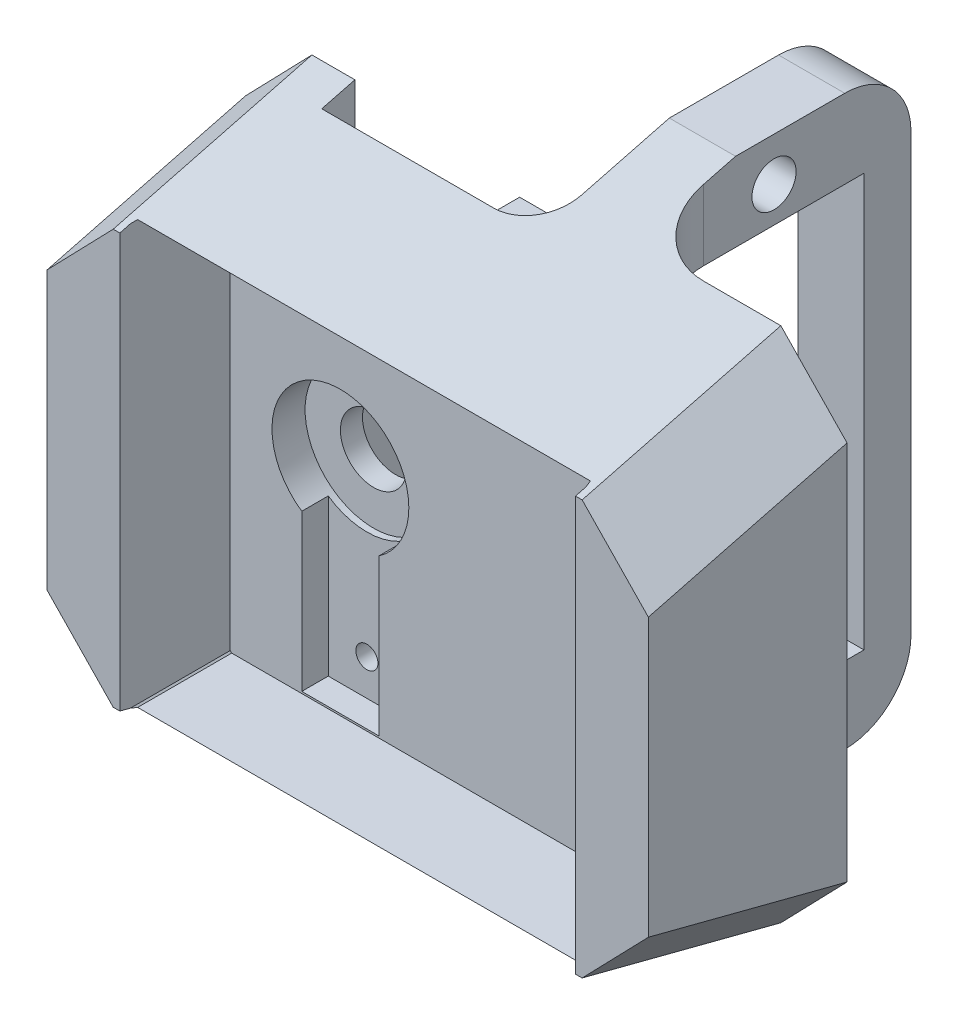
from build123d import *

# Parameters (mm, degrees)
SKETCH1_W                = 12.409227922
SKETCH1_H                = 25.738488059
SKETCH1_R                = 1
SKETCH1_W_2              = 8.15
SKETCH1_H_2              = 18.7
BOSS_EXTRUDE1_DEPTH      = 3
SKETCH15_W               = 27.240995133
SKETCH15_H               = 25.738488059
BOSS_EXTRUDE5_DEPTH      = 4
SKETCH16_R               = 3.1
CUT_EXTRUDE12_DEPTH      = 1.5
CUT_EXTRUDE13_DEPTH      = 1.2
CHAMFER1_SIZE            = 2
CUT_EXTRUDE14_DEPTH      = 31.943326143
CUT_EXTRUDE14_DEPTH_BACK = 31.943326143
SKETCH18_R               = 1.5
SKETCH18_R_2             = 0.5
FILLET1_R                = 3
FILLET2_R                = 3
BOSS_EXTRUDE7_DEPTH      = 5
CUT_EXTRUDE15_DEPTH      = 39.151604311
CUT_EXTRUDE15_DEPTH_BACK = 39.151604311
CHAMFER2_SIZE            = 3
SKETCH23_R               = 3.318889956
SKETCH23_R_2             = 1.409018686
CUT_EXTRUDE17_DEPTH      = 1
FILLET4_R                = 3
BOSS_EXTRUDE8_DEPTH      = 12.409227923
SKETCH25_R               = 1.5
CUT_EXTRUDE18_DEPTH      = 13
SKETCH26_R               = 2.992034133
CUT_EXTRUDE19_DEPTH      = 1
FILLET5_SIZE             = 8
FILLET6_R                = 4
SKETCH27_W               = 9.781799862
SKETCH27_H               = 23.423713079
CUT_EXTRUDE20_DEPTH      = 1.5
FILLET7_R                = 2


with BuildPart() as part:
    # Sketch1 → Boss-Extrude1 (new body)
    with BuildSketch(Plane(origin=(0, 0, 0), x_dir=(0, 0, -1), z_dir=(1, 0, 0))):
        with Locations((1.233520205, 9.896555647)):
            Rectangle(SKETCH1_W, SKETCH1_H)
        with Locations((1.233520205, 20.798227972)):
            Circle(SKETCH1_R, mode=Mode.SUBTRACT)
        with Locations((1.233520205, -1.111772028)):
            Circle(SKETCH1_R, mode=Mode.SUBTRACT)
        with Locations((1.233520205, 9.843227972)):
            Rectangle(SKETCH1_W_2, SKETCH1_H_2, mode=Mode.SUBTRACT)
    extrude(amount=BOSS_EXTRUDE1_DEPTH)

    # Sketch15 → Boss-Extrude5 (add)
    with BuildSketch(Plane.XY.offset(4.971093756)):
        with Locations((-1.10779903, 9.896555647)):
            Rectangle(SKETCH15_W, SKETCH15_H)
    extrude(amount=BOSS_EXTRUDE5_DEPTH)

    # Sketch16 → Cut-Extrude12 (cut)
    with BuildSketch(Plane.XY.offset(8.971093756)):
        with Locations((-6.437606402, 10.038669905)):
            Circle(SKETCH16_R)
    extrude(amount=-CUT_EXTRUDE12_DEPTH, mode=Mode.SUBTRACT)

    # Sketch17 → Cut-Extrude13 (cut)
    with BuildSketch(Plane.XY.offset(8.971093756)):
        Polygon((-6.437606402, 10.038669905), (-8.187606402, 10.038669905), (-8.187606402, 0.412009525), (-4.687606402, 0.412009525), (-4.687606402, 10.038669905), align=None)
    extrude(amount=-CUT_EXTRUDE13_DEPTH, mode=Mode.SUBTRACT)

    # Chamfer1
    chamfer1_edges = [part.edges().sort_by_distance(p)[0] for p in [
        (-14.728296596, 22.765799677, 6.971093756),
        (-14.728296596, -2.972688382, 6.971093756),
        (12.512698537, -2.972688382, 6.971093756),
        (12.512698537, 22.765799677, 6.971093756),
    ]]
    chamfer(chamfer1_edges, length=CHAMFER1_SIZE)

    # Sketch18 → Cut-Extrude14 (cut, two sides: drawn at the far end of the back side and taken through both)
    with BuildSketch(Plane.XY.offset(7.471093756).offset(-CUT_EXTRUDE14_DEPTH_BACK)):
        with Locations((-6.437606402, 10.038669905)):
            Circle(SKETCH18_R)
        with Locations((-6.437606402, 2.038669905)):
            Circle(SKETCH18_R_2)
    extrude(amount=CUT_EXTRUDE14_DEPTH + CUT_EXTRUDE14_DEPTH_BACK, mode=Mode.SUBTRACT)

    # Fillet1
    fillet1_edges = [part.edges().sort_by_distance(p)[0] for p in [
        (1.5, -2.972688382, -7.438134166),
        (1.5, 22.765799677, -7.438134166),
    ]]
    fillet(fillet1_edges, radius=FILLET1_R)

    # Fillet2
    # the kernel refuses this fillet: 3 mm, written as the material it adds along each edge
    with BuildSketch(Plane(origin=(3, -2.972688382, 4.971093756), x_dir=(0, 0, -1), z_dir=(0, 1, 0))) as fillet2_piece_1_section:
        with BuildLine():
            CenterArc((FILLET2_R, -FILLET2_R), FILLET2_R, 90, 90)
            Line((0, -FILLET2_R), (0, 0))
            Line((0, 0), (FILLET2_R, 0))
        make_face()
    fillet2_piece_1 = extrude(amount=25.738488059, mode=Mode.PRIVATE)
    fillet2_piece_1 = split(fillet2_piece_1, bisect_by=Plane(origin=(3, -2.972688382, 2.841479795), z_dir=(0, 0, -1)), keep=Keep.TOP, mode=Mode.PRIVATE)
    fillet2_piece_1 = split(fillet2_piece_1, bisect_by=Plane(origin=(3, 0.493227972, 4.971093756), z_dir=(0, -1, 0)), keep=Keep.TOP, mode=Mode.PRIVATE)
    add(fillet2_piece_1)
    with BuildSketch(Plane(origin=(3, -2.972688382, 4.971093756), x_dir=(0, 0, -1), z_dir=(0, 1, 0))) as fillet2_piece_2_section:
        with BuildLine():
            CenterArc((FILLET2_R, -FILLET2_R), FILLET2_R, 90, 90)
            Line((0, -FILLET2_R), (0, 0))
            Line((0, 0), (FILLET2_R, 0))
        make_face()
    fillet2_piece_2 = extrude(amount=25.738488059, mode=Mode.PRIVATE)
    fillet2_piece_2 = split(fillet2_piece_2, bisect_by=Plane(origin=(3, -2.972688382, 2.841479795), z_dir=(0, 0, 1)), keep=Keep.TOP, mode=Mode.PRIVATE)
    fillet2_piece_2 = split(fillet2_piece_2, bisect_by=Plane(origin=(3, 0.493227972, 4.971093756), z_dir=(0, -1, 0)), keep=Keep.TOP, mode=Mode.PRIVATE)
    add(fillet2_piece_2)
    with BuildSketch(Plane(origin=(3, -2.972688382, 4.971093756), x_dir=(0, 0, -1), z_dir=(0, 1, 0))) as fillet2_piece_3_section:
        with BuildLine():
            CenterArc((FILLET2_R, -FILLET2_R), FILLET2_R, 90, 90)
            Line((0, -FILLET2_R), (0, 0))
            Line((0, 0), (FILLET2_R, 0))
        make_face()
    fillet2_piece_3 = extrude(amount=25.738488059, mode=Mode.PRIVATE)
    fillet2_piece_3 = split(fillet2_piece_3, bisect_by=Plane(origin=(3, 19.193227972, 4.971093756), z_dir=(0, -1, 0)), keep=Keep.TOP, mode=Mode.PRIVATE)
    fillet2_piece_3 = split(fillet2_piece_3, bisect_by=Plane(origin=(3, -2.972688382, 2.841479795), z_dir=(0, 0, 1)), keep=Keep.TOP, mode=Mode.PRIVATE)
    fillet2_piece_3 = split(fillet2_piece_3, bisect_by=Plane(origin=(3, 0.493227972, 4.971093756), z_dir=(0, 1, 0)), keep=Keep.TOP, mode=Mode.PRIVATE)
    add(fillet2_piece_3)
    with BuildSketch(Plane(origin=(3, -2.972688382, 4.971093756), x_dir=(0, 0, -1), z_dir=(0, 1, 0))) as fillet2_piece_4_section:
        with BuildLine():
            CenterArc((FILLET2_R, -FILLET2_R), FILLET2_R, 90, 90)
            Line((0, -FILLET2_R), (0, 0))
            Line((0, 0), (FILLET2_R, 0))
        make_face()
    fillet2_piece_4 = extrude(amount=25.738488059, mode=Mode.PRIVATE)
    fillet2_piece_4 = split(fillet2_piece_4, bisect_by=Plane(origin=(3, 19.193227972, 4.971093756), z_dir=(0, 1, 0)), keep=Keep.TOP, mode=Mode.PRIVATE)
    fillet2_piece_4 = split(fillet2_piece_4, bisect_by=Plane(origin=(3, -2.972688382, 2.841479795), z_dir=(0, 0, -1)), keep=Keep.TOP, mode=Mode.PRIVATE)
    add(fillet2_piece_4)
    with BuildSketch(Plane(origin=(3, -2.972688382, 4.971093756), x_dir=(0, 0, -1), z_dir=(0, 1, 0))) as fillet2_piece_5_section:
        with BuildLine():
            CenterArc((FILLET2_R, -FILLET2_R), FILLET2_R, 90, 90)
            Line((0, -FILLET2_R), (0, 0))
            Line((0, 0), (FILLET2_R, 0))
        make_face()
    fillet2_piece_5 = extrude(amount=25.738488059, mode=Mode.PRIVATE)
    fillet2_piece_5 = split(fillet2_piece_5, bisect_by=Plane(origin=(3, 19.193227972, 4.971093756), z_dir=(0, 1, 0)), keep=Keep.TOP, mode=Mode.PRIVATE)
    fillet2_piece_5 = split(fillet2_piece_5, bisect_by=Plane(origin=(3, -2.972688382, 2.841479795), z_dir=(0, 0, 1)), keep=Keep.TOP, mode=Mode.PRIVATE)
    add(fillet2_piece_5)

    # Sketch20 → Boss-Extrude7 (add)
    with BuildSketch(Plane.XY.offset(8.971093756)):
        Polygon((-12.728296596, 22.765799677), (-14.728296596, 20.765799677), (-14.728296596, -0.972688382), (-12.728296596, -2.972688382), (10.512698537, -2.972688382), (12.512698537, -0.972688382), (12.512698537, 20.765799677), (10.512698537, 22.765799677), align=None)
        Polygon((9.145793781, 0.327311618), (9.212698537, 0.394216374), (9.212698537, 19.398894921), (9.145793781, 19.465799677), (-11.36139184, 19.465799677), (-11.428296596, 19.398894921), (-11.428296596, 0.394216374), (-11.36139184, 0.327311618), align=None, mode=Mode.SUBTRACT)
    extrude(amount=BOSS_EXTRUDE7_DEPTH)

    # Sketch21 → Cut-Extrude15 (cut, two sides: drawn at the far end of the back side and taken through both)
    with BuildSketch(Plane.ZY.offset(14.728296596).offset(-CUT_EXTRUDE15_DEPTH_BACK)):
        Polygon((0.508600598, 22.765799677), (13.971093756, 19.274181739), (13.971093756, 24.16200456), (0.508600598, 24.16200456), align=None)
        Polygon((0.508600598, -4.368893265), (0.508600598, -2.972688382), (13.971093756, 0.518929556), (13.971093756, -4.368893265), align=None)
    extrude(amount=CUT_EXTRUDE15_DEPTH + CUT_EXTRUDE15_DEPTH_BACK, mode=Mode.SUBTRACT)

    # Chamfer2
    chamfer2_edges = [part.edges().sort_by_distance(p)[0] for p in [
        (-14.728296596, -0.226879413, 11.095507618),
        (12.512698537, 20.019990708, 11.095507618),
        (12.512698537, -0.226879413, 11.095507618),
        (-14.728296596, 20.019990708, 11.095507618),
    ]]
    chamfer(chamfer2_edges, length=CHAMFER2_SIZE)

    # Sketch23 → Cut-Extrude17 (cut)
    with BuildSketch(Plane(origin=(0, 0, 4.971093756), x_dir=(-1, 0, 0), z_dir=(0, 0, -1))):
        with Locations((6.437606402, 10.038669905)):
            Circle(SKETCH23_R)
        with Locations((6.437606402, 2.038669905)):
            Circle(SKETCH23_R_2)
    extrude(amount=-CUT_EXTRUDE17_DEPTH, mode=Mode.SUBTRACT)

    # Fillet4
    # the kernel refuses this fillet: 3 mm, written as the material it adds along each edge
    with BuildSketch(Plane(origin=(9.212698537, -7.105783626, 8.971093756), x_dir=(0, 0, 1), z_dir=(0, 1, 0))) as fillet4_piece_1_section:
        with BuildLine():
            CenterArc((FILLET4_R, -FILLET4_R), FILLET4_R, 90, 90)
            Line((0, -FILLET4_R), (0, 0))
            Line((0, 0), (FILLET4_R, 0))
        make_face()
    fillet4_piece_1 = extrude(amount=34.004678547, mode=Mode.PRIVATE)
    fillet4_piece_1 = split(fillet4_piece_1, bisect_by=Plane(origin=(9.212698537, 19.465799677, 8.971093756), z_dir=(0, -1, 0)), keep=Keep.TOP, mode=Mode.PRIVATE)
    fillet4_piece_1 = split(fillet4_piece_1, bisect_by=Plane(origin=(9.212698537, 0.327311618, 8.971093756), z_dir=(0, 1, 0)), keep=Keep.TOP, mode=Mode.PRIVATE)
    add(fillet4_piece_1)
    with BuildSketch(Plane(origin=(16.645793781, 19.465799677, 8.971093756), x_dir=(0, 0, 1), z_dir=(-1, 0, 0))) as fillet4_piece_2_section:
        with BuildLine():
            CenterArc((FILLET4_R, -FILLET4_R), FILLET4_R, 90, 90)
            Line((0, -FILLET4_R), (0, 0))
            Line((0, 0), (FILLET4_R, 0))
        make_face()
    fillet4_piece_2 = extrude(amount=35.50718562, mode=Mode.PRIVATE)
    fillet4_piece_2 = split(fillet4_piece_2, bisect_by=Plane(origin=(12.895793781, 15.715799677, 8.971093756), z_dir=(-0.707106781186557, -0.7071067811865381, 0)), keep=Keep.TOP, mode=Mode.PRIVATE)
    fillet4_piece_2 = split(fillet4_piece_2, bisect_by=Plane(origin=(-11.428296596, 19.465799677, 8.971093756), z_dir=(1, 0, 0)), keep=Keep.TOP, mode=Mode.PRIVATE)
    add(fillet4_piece_2)

    # Sketch24 → Boss-Extrude8 (add)
    with BuildSketch(Plane(origin=(0, 0, 4.971093756), x_dir=(-1, 0, 0), z_dir=(0, 0, -1))):
        Polygon((14.728296596, 8.32475399), (9.781799862, 8.32475399), (9.781799862, -1.815300892), (11.728296596, -1.815300892), (14.728296596, 1.283957653), align=None)
    extrude(amount=BOSS_EXTRUDE8_DEPTH)

    # Sketch25 → Cut-Extrude18 (cut)
    with BuildSketch(Plane.ZY.offset(14.728296596)):
        with Locations((-1.233520205, 4.70072857)):
            Circle(SKETCH25_R)
    extrude(amount=-CUT_EXTRUDE18_DEPTH, mode=Mode.SUBTRACT)

    # Sketch26 → Cut-Extrude19 (cut)
    with BuildSketch(Plane.ZY.offset(14.728296596)):
        with Locations((-1.233520205, 4.70072857)):
            Circle(SKETCH26_R)
    extrude(amount=-CUT_EXTRUDE19_DEPTH, mode=Mode.SUBTRACT)

    # Fillet5
    # a fillet whose section is not a circle: 8 mm, written as the material it adds along each edge
    with BuildSketch(Plane(origin=(-14.728296596, 8.32475399, 4.971093756), x_dir=(0, 1, 0), z_dir=(1, 0, 0))) as fillet5_piece_1:
        with BuildLine():
            Bezier((FILLET5_SIZE, 0), (0, 0), (0, -FILLET5_SIZE), weights=[1, 0.538461538, 1])
            Line((0, -FILLET5_SIZE), (0, 0))
            Line((0, 0), (FILLET5_SIZE, 0))
        make_face()
    extrude(amount=4.946496733)

    # Fillet6
    fillet6_edges = [part.edges().sort_by_distance(p)[0] for p in [
        (-10.755048229, -1.815300892, -7.438134167),
    ]]
    fillet(fillet6_edges, radius=FILLET6_R)

    # Sketch27 → Cut-Extrude20 (cut)
    with BuildSketch(Plane(origin=(0, 0, 4.971093756), x_dir=(-1, 0, 0), z_dir=(0, 0, -1))):
        with Locations((4.890899931, 9.896555648)):
            Rectangle(SKETCH27_W, SKETCH27_H)
    extrude(amount=-CUT_EXTRUDE20_DEPTH, mode=Mode.SUBTRACT)

    # Fillet7
    fillet7_edges = [part.edges().sort_by_distance(p)[0] for p in [
        (0, 9.896555648, 6.471093756),
    ]]
    fillet(fillet7_edges, radius=FILLET7_R)


solid = part.part
